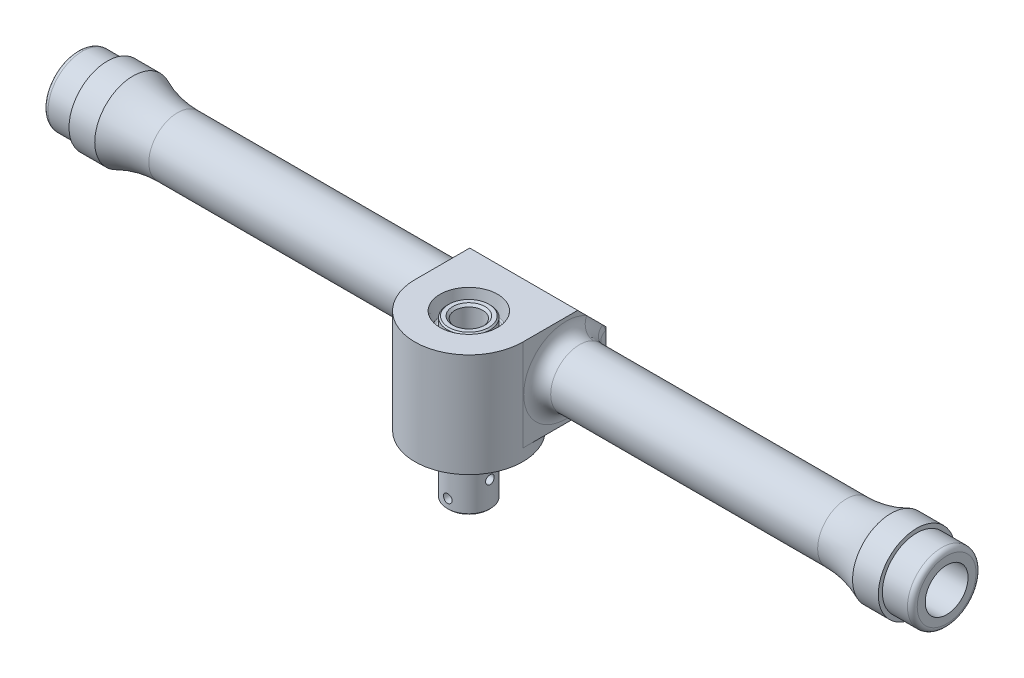
from build123d import *

# Parameters (mm, degrees)
SZKIC1_W                         = 40
SZKIC1_H                         = 50.73
DODANIE_WYCI_GNI_CIE1_DEPTH      = 34.04
ZAOKR_GLENIE2_RADIUS             = 20
ZAOKR_GLENIE2_LENGTH             = 34.04
SZKIC2_R                         = 20
DODANIE_WYCI_GNI_CIE2_DEPTH      = 4.39
SZKIC3_R                         = 17.5
WYTNIJ_WYCI_GNI_CIE1_DEPTH       = 1.27
SZKIC4_R                         = 10.67
WYTNIJ_WYCI_GNI_CIE2_DEPTH       = 6.6
DODANIE_WYCI_GNI_CIE4_DEPTH      = 22.86
DODANIE_WYCI_GNI_CIE4_DEPTH_BACK = 35.56
SZKIC5_R                         = 7.94
SZKIC6_R                         = 5.16
WYTNIJ_WYCI_GNI_CIE3_DEPTH       = 58.42
SFAZOWANIE1_SIZE                 = 10.41
SZKIC7_R                         = 10.67
DODANIE_WYCI_GNI_CIE5_DEPTH      = 120.4
SZKIC8_R                         = 14.225
DODANIE_WYCI_GNI_CIE6_DEPTH      = 9.53
SZKIC9_R                         = 12.7
DODANIE_WYCI_GNI_CIE7_DEPTH      = 11.11
ZAOKR_GLENIE3_R                  = 40
ZAOKR_GLENIE4_R                  = 5
ZAOKR_GLENIE5_R                  = 1.8
ZAOKR_GLENIE3_OF_LUSTRO2_R       = 40
ZAOKR_GLENIE4_OF_LUSTRO2_R       = 5
ZAOKR_GLENIE5_OF_LUSTRO2_R       = 1.8
WYTNIJ_WYCI_GNI_CIE4_DEPTH       = 325.865558711
WYTNIJ_WYCI_GNI_CIE4_DEPTH_BACK  = 325.865558711
SZKIC10_R                        = 7.94
POCHYLENIE2_ANGLE                = 8
ZAOKR_GLENIE7_R                  = 0.5
SFAZOWANIE2_SIZE                 = 0.81
SFAZOWANIE3_SIZE                 = 0.51
WYTNIJ_WYCI_GNI_CIE5_DEPTH       = 167.541245453
WYTNIJ_WYCI_GNI_CIE5_DEPTH_BACK  = 167.541245453
SZKIC11_R                        = 1.59
WYTNIJ_WYCI_GNI_CIE6_DEPTH       = 167.541245453
WYTNIJ_WYCI_GNI_CIE6_DEPTH_BACK  = 167.541245453
SZKIC13_R                        = 1.59


with BuildPart() as part:
    # Szkic1 → Dodanie-wyciągnięcie1 (new body)
    with BuildSketch(Plane(origin=(0, 0, 0), x_dir=(1, 0, 0), z_dir=(0, 1, 0))):
        Rectangle(SZKIC1_W, SZKIC1_H)
    extrude(amount=DODANIE_WYCI_GNI_CIE1_DEPTH)

    # Zaokrąglenie2: full round fillet: the end face becomes a half cylinder, R = half its width
    zaokr_glenie2_face = Plane((0, 17.02, 25.365), x_dir=(0, 1, 0), z_dir=(0, 0, 1))  # on the end face: x along it, z out of the body
    zaokr_glenie2_slab = zaokr_glenie2_face.offset(-ZAOKR_GLENIE2_RADIUS / 2) * Box(ZAOKR_GLENIE2_LENGTH, 2 * ZAOKR_GLENIE2_RADIUS, ZAOKR_GLENIE2_RADIUS, mode=Mode.PRIVATE)  # the body's end, R deep
    zaokr_glenie2_round = Plane((0, 17.02, 5.365), x_dir=(0, 0, 1), z_dir=(0, 1, 0)) * Cylinder(ZAOKR_GLENIE2_RADIUS, ZAOKR_GLENIE2_LENGTH, mode=Mode.PRIVATE)  # its axis R under the face
    add(zaokr_glenie2_slab - zaokr_glenie2_round, mode=Mode.SUBTRACT)

    # Szkic2 → Dodanie-wyciągnięcie2 (add)
    with BuildSketch(Plane(origin=(0, 0, 0), x_dir=(-1, 0, 0), z_dir=(0, -1, 0))):
        with Locations(Location((0, -5.365, 0), (0, 0, 90))):
            Circle(SZKIC2_R)
    extrude(amount=DODANIE_WYCI_GNI_CIE2_DEPTH)

    # Szkic3 → Wytnij-wyciągnięcie1 (cut)
    with BuildSketch(Plane(origin=(0, -4.39, 0), x_dir=(-1, 0, 0), z_dir=(0, -1, 0))):
        with Locations(Location((0, -5.365, 0), (0, 0, 90))):
            Circle(SZKIC3_R)
    extrude(amount=-WYTNIJ_WYCI_GNI_CIE1_DEPTH, mode=Mode.SUBTRACT)

    # Szkic4 → Wytnij-wyciągnięcie2 (cut)
    with BuildSketch(Plane(origin=(0, 34.04, 0), x_dir=(1, 0, 0), z_dir=(0, 1, 0))):
        with Locations(Location((0, -5.365, 0), (0, 0, 270))):
            Circle(SZKIC4_R)
    extrude(amount=-WYTNIJ_WYCI_GNI_CIE2_DEPTH, mode=Mode.SUBTRACT)

    # Szkic5 → Dodanie-wyciągnięcie4 (add, two sides: drawn at the far end of the back side and taken through both)
    with BuildSketch(Plane(origin=(0, -3.12, 0), x_dir=(-1, 0, 0), z_dir=(0, -1, 0)).offset(-DODANIE_WYCI_GNI_CIE4_DEPTH_BACK)):
        with Locations(Location((0, -5.365, 0), (0, 0, 90))):
            Circle(SZKIC5_R)
    extrude(amount=DODANIE_WYCI_GNI_CIE4_DEPTH + DODANIE_WYCI_GNI_CIE4_DEPTH_BACK)

    # Szkic6 → Wytnij-wyciągnięcie3 (cut)
    with BuildSketch(Plane(origin=(0, -25.98, 0), x_dir=(-1, 0, 0), z_dir=(0, -1, 0))):
        with Locations(Location((0, -5.365, 0), (0, 0, 90))):
            Circle(SZKIC6_R)
    extrude(amount=-WYTNIJ_WYCI_GNI_CIE3_DEPTH, mode=Mode.SUBTRACT)

    # Sfazowanie1
    sfazowanie1_edges = [part.edges().sort_by_distance(p)[0] for p in [
        (0, 34.04, -25.365),
        (0, 0, -25.365),
    ]]
    chamfer(sfazowanie1_edges, length=SFAZOWANIE1_SIZE)

    # Szkic7 → Dodanie-wyciągnięcie5 (add)
    with BuildSketch(Plane.ZY.offset(20)):
        with Locations(Location((-10.635, 17.02, 0), (0, 0, 180))):
            Circle(SZKIC7_R)
    dodanie_wyci_gni_cie5 = extrude(amount=DODANIE_WYCI_GNI_CIE5_DEPTH)

    # Szkic8 → Dodanie-wyciągnięcie6 (add)
    with BuildSketch(Plane.ZY.offset(140.4)):
        with Locations((-10.635, 17.02)):
            Circle(SZKIC8_R)
    dodanie_wyci_gni_cie6 = extrude(amount=DODANIE_WYCI_GNI_CIE6_DEPTH)

    # Szkic9 → Dodanie-wyciągnięcie7 (add)
    with BuildSketch(Plane.ZY.offset(149.93)):
        with Locations((-10.635, 17.02)):
            Circle(SZKIC9_R)
    dodanie_wyci_gni_cie7 = extrude(amount=DODANIE_WYCI_GNI_CIE7_DEPTH)

    # Zaokrąglenie3
    # the kernel refuses this fillet: 40 mm, written as the material it adds along each edge
    with BuildSketch(Plane(origin=(-140.4, 17.02, -10.635), x_dir=(0, 0, -1), z_dir=(0, 1, 0))) as zaokr_glenie3_piece_1:
        with BuildLine():
            CenterArc((50.67, -16.48520473), ZAOKR_GLENIE3_R, 155.661284082, 24.338715918)
            Line((10.67, -16.48520473), (9.87, -16.48520473))
            Line((9.87, -16.48520473), (9.87, 0))
            Line((9.87, 0), (10.67, 0.8))
            ThreePointArc((10.67, 0.8), (12.4475, 0.8), (13.4961, 0.329704095))
            Line((13.4961, 0.329704095), (14.225, 0))
        make_face()
    revolve(axis=Axis((-140.4, 17.02, -10.635), (-1, 0, 0)))

    # Zaokrąglenie4
    zaokr_glenie4_edges = [part.edges().sort_by_distance(p)[0] for p in [
        (-20, 17.02, 0.035),
    ]]
    fillet(zaokr_glenie4_edges, radius=ZAOKR_GLENIE4_R)

    # Zaokrąglenie5
    zaokr_glenie5_edges = [part.edges().sort_by_distance(p)[0] for p in [
        (-161.04, 17.02, -23.335),
    ]]
    fillet(zaokr_glenie5_edges, radius=ZAOKR_GLENIE5_R)

    # Lustro2: Dodanie-wyciągnięcie5, Dodanie-wyciągnięcie6, Dodanie-wyciągnięcie7 across plane
    add(dodanie_wyci_gni_cie5.mirror(Plane(origin=(0, 0, 0), x_dir=(0, 0, 1), z_dir=(1, 0, 0))))
    add(dodanie_wyci_gni_cie6.mirror(Plane(origin=(0, 0, 0), x_dir=(0, 0, 1), z_dir=(1, 0, 0))))
    add(dodanie_wyci_gni_cie7.mirror(Plane(origin=(0, 0, 0), x_dir=(0, 0, 1), z_dir=(1, 0, 0))))

    # Zaokrąglenie3 of Lustro2
    # the kernel refuses this fillet: 40 mm, written as the material it adds along each edge
    with BuildSketch(Plane(origin=(140.4, 17.02, -10.635), x_dir=(0, 0, -1), z_dir=(0, 1, 0))) as zaokr_glenie3_of_lustro2_piece_1:
        with BuildLine():
            CenterArc((50.67, 16.48520473), ZAOKR_GLENIE3_OF_LUSTRO2_R, 180, 24.338715918)
            Line((10.67, 16.48520473), (9.87, 16.48520473))
            Line((9.87, 16.48520473), (9.87, 0))
            Line((9.87, 0), (10.67, -0.8))
            ThreePointArc((10.67, -0.8), (12.4475, -0.8), (13.4961, -0.329704095))
            Line((13.4961, -0.329704095), (14.225, 0))
        make_face()
    revolve(axis=Axis((140.4, 17.02, -10.635), (-1, 0, 0)))

    # Zaokrąglenie4 of Lustro2
    zaokr_glenie4_of_lustro2_edges = [part.edges().sort_by_distance(p)[0] for p in [
        (20, 17.02, 0.035),
    ]]
    fillet(zaokr_glenie4_of_lustro2_edges, radius=ZAOKR_GLENIE4_OF_LUSTRO2_R)

    # Zaokrąglenie5 of Lustro2
    zaokr_glenie5_of_lustro2_edges = [part.edges().sort_by_distance(p)[0] for p in [
        (161.04, 17.02, -23.335),
    ]]
    fillet(zaokr_glenie5_of_lustro2_edges, radius=ZAOKR_GLENIE5_OF_LUSTRO2_R)

    # Szkic10 → Wytnij-wyciągnięcie4 (cut, two sides: drawn at the far end of the back side and taken through both)
    with BuildSketch(Plane.ZY.offset(161.04).offset(-WYTNIJ_WYCI_GNI_CIE4_DEPTH_BACK)):
        with Locations(Location((-10.635, 17.02, 0), (0, 0, 180))):
            Circle(SZKIC10_R)
    extrude(amount=WYTNIJ_WYCI_GNI_CIE4_DEPTH + WYTNIJ_WYCI_GNI_CIE4_DEPTH_BACK, mode=Mode.SUBTRACT)

    # Pochylenie2
    pochylenie2_faces = [part.faces().sort_by_distance(p)[0] for p in [
        (0, 30.74, -5.305),
    ]]
    draft(pochylenie2_faces, Plane.ZX.offset(34.04), POCHYLENIE2_ANGLE)

    # Zaokrąglenie7
    zaokr_glenie7_edges = [part.edges().sort_by_distance(p)[0] for p in [
        (0, 27.44, -4.377430491),
        (0, 27.44, 13.305),
    ]]
    fillet(zaokr_glenie7_edges, radius=ZAOKR_GLENIE7_R)

    # Sfazowanie2
    sfazowanie2_edges = [part.edges().sort_by_distance(p)[0] for p in [
        (0, -25.98, 10.525),
        (0, 32.44, 10.525),
    ]]
    chamfer(sfazowanie2_edges, length=SFAZOWANIE2_SIZE)

    # Sfazowanie3
    sfazowanie3_edges = [part.edges().sort_by_distance(p)[0] for p in [
        (0, 32.44, 13.305),
        (0, -25.98, 13.305),
    ]]
    chamfer(sfazowanie3_edges, length=SFAZOWANIE3_SIZE)

    # Szkic11 → Wytnij-wyciągnięcie5 (cut, two sides: drawn at the far end of the back side and taken through both)
    with BuildSketch(Plane.XY.offset(-WYTNIJ_WYCI_GNI_CIE5_DEPTH_BACK)):
        with Locations((0, -22.17)):
            Circle(SZKIC11_R)
    extrude(amount=WYTNIJ_WYCI_GNI_CIE5_DEPTH + WYTNIJ_WYCI_GNI_CIE5_DEPTH_BACK, mode=Mode.SUBTRACT)

    # Szkic13 → Wytnij-wyciągnięcie6 (cut, two sides: drawn at the far end of the back side and taken through both)
    with BuildSketch(Plane(origin=(0, 0, 0), x_dir=(0, 0, -1), z_dir=(1, 0, 0)).offset(-WYTNIJ_WYCI_GNI_CIE6_DEPTH_BACK)):
        with Locations((-5.365, -16.13)):
            Circle(SZKIC13_R)
    extrude(amount=WYTNIJ_WYCI_GNI_CIE6_DEPTH + WYTNIJ_WYCI_GNI_CIE6_DEPTH_BACK, mode=Mode.SUBTRACT)


solid = part.part
